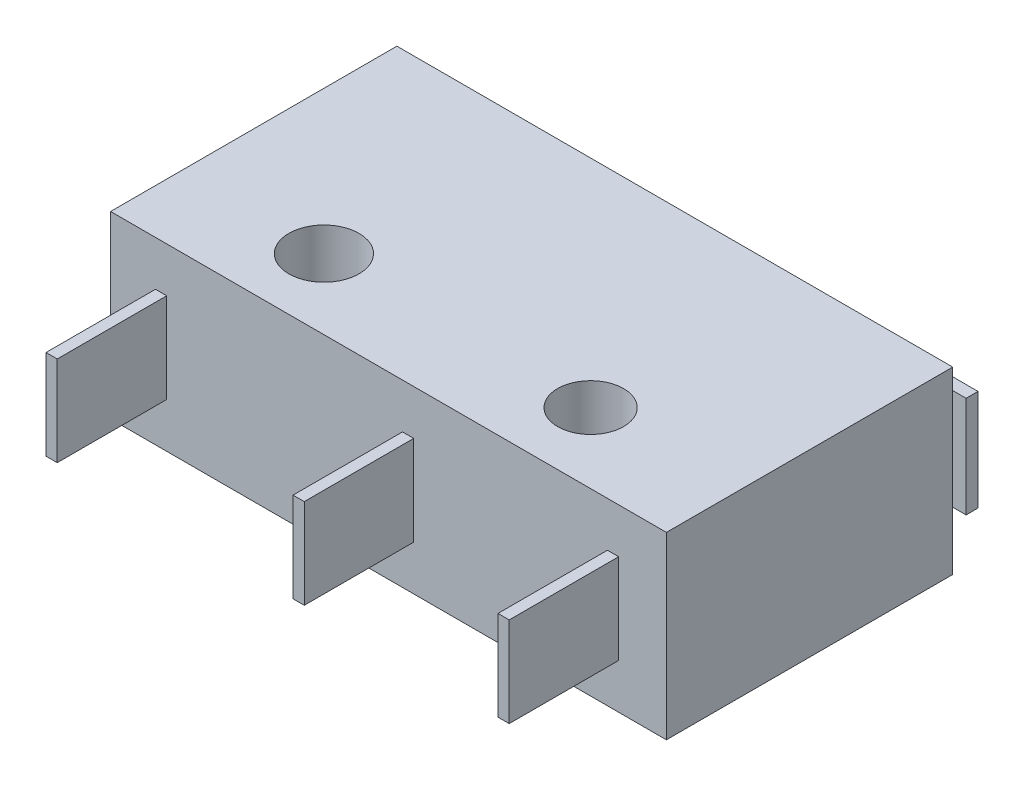
from build123d import *

# Parameters (mm, degrees)
SKETCH1_W               = 19.8
SKETCH1_H               = 10.2
BOSS_EXTRUDE1_DEPTH     = 3.2
CUT_EXTRUDE1_DEPTH      = 12.58706175
CUT_EXTRUDE1_DEPTH_BACK = 12.58706175
SKETCH2_R               = 1.25
SKETCH2_R_2             = 1.175
BOSS_EXTRUDE2_DEPTH     = 1.8
SKETCH4_W               = 0.4
SKETCH4_H               = 3.2
BOSS_EXTRUDE3_DEPTH     = 3.9
LPATTERN1_COUNT         = 2
LPATTERN1_PITCH         = 8.8
LPATTERN2_COUNT         = 2
LPATTERN2_PITCH         = 16.1
SKETCH5_R               = 0.507136528
BOSS_EXTRUDE4_DEPTH     = 1.7


with BuildPart() as part:
    # Sketch1 → Boss-Extrude1 (new, symmetric)
    with BuildSketch(Plane(origin=(0, 0, 0), x_dir=(1, 0, 0), z_dir=(0, 1, 0))):
        Rectangle(SKETCH1_W, SKETCH1_H)
    extrude(amount=BOSS_EXTRUDE1_DEPTH, both=True)

    # Sketch2 → Cut-Extrude1 (cut, two sides: drawn at the far end of the back side and taken through both)
    with BuildSketch(Plane(origin=(0, 0, 0), x_dir=(1, 0, 0), z_dir=(0, 1, 0)).offset(-CUT_EXTRUDE1_DEPTH_BACK)):
        with Locations((-4.8, -2.6)):
            Circle(SKETCH2_R)
        with Locations((4.7, -2.6)):
            Circle(SKETCH2_R_2)
    extrude(amount=CUT_EXTRUDE1_DEPTH + CUT_EXTRUDE1_DEPTH_BACK, mode=Mode.SUBTRACT)

    # Sketch3 → Boss-Extrude2 (add, symmetric)
    with BuildSketch(Plane(origin=(0, 0, 0), x_dir=(1, 0, 0), z_dir=(0, 1, 0))):
        Polygon((-7.306635191, 5.1), (-7.306635191, 6.2), (9.7, 6.2), (9.7, 5.775620591), (-6.694229351, 5.775620591), (-6.694229351, 5.1), align=None)
    extrude(amount=BOSS_EXTRUDE2_DEPTH, both=True)

    # Sketch4 → Boss-Extrude3 (add)
    with BuildSketch(Plane.XY.offset(5.1)):
        with Locations((-8.1, 0)):
            Rectangle(SKETCH4_W, SKETCH4_H)
    boss_extrude3 = extrude(amount=BOSS_EXTRUDE3_DEPTH)

    # LPattern1: Boss-Extrude3 ×2
    with Locations(*[(i * LPATTERN1_PITCH, 0, 0) for i in range(1, LPATTERN1_COUNT)]):
        add(boss_extrude3)

    # LPattern2: Boss-Extrude3 ×2
    with Locations(*[(i * LPATTERN2_PITCH, 0, 0) for i in range(1, LPATTERN2_COUNT)]):
        add(boss_extrude3)

    # Sketch5 → Boss-Extrude4 (add, symmetric)
    with BuildSketch(Plane(origin=(0, 0, 0), x_dir=(1, 0, 0), z_dir=(0, 1, 0))):
        with Locations((-3.307427246, 5.1)):
            Circle(SKETCH5_R)
    extrude(amount=BOSS_EXTRUDE4_DEPTH, both=True)


solid = part.part
